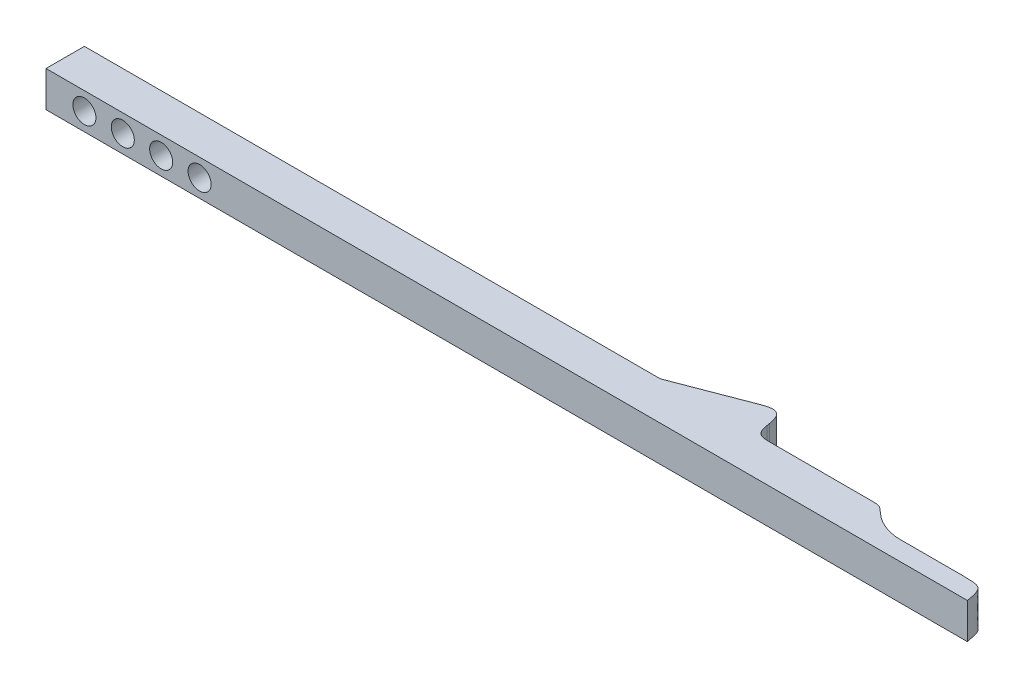
from build123d import *

# Parameters (mm, degrees)
ESBO_O1_W                = 5
ESBO_O1_H                = 4.65
RESSALTO_EXTRUS_O1_DEPTH = 120
RESSALTO_EXTRUS_O2_DEPTH = 4.75
F_3_0MM_DOWEL_HOLE3_D    = 3
CUT_EXTRUDE2_DEPTH       = 10
FILLET4_START            = -3
FILLET4_DEPTH            = 6
FILLET1_SIZE             = 0.5
FILLET6_START            = -2.325
FILLET6_DEPTH            = 4.65
FILLET7_START            = -2.325
FILLET7_DEPTH            = 4.65


with BuildPart() as part:
    # Esboço1 → Ressalto-extrusão1 (new body)
    with BuildSketch(Plane(origin=(0, 0, 0), x_dir=(0, 0, -1), z_dir=(1, 0, 0))):
        with Locations((-2.5, 0)):
            Rectangle(ESBO_O1_W, ESBO_O1_H)
    extrude(amount=RESSALTO_EXTRUS_O1_DEPTH)

    # Esboço2 → Ressalto-extrusão2 (add)
    with BuildSketch(Plane(origin=(0, 2.325, 0), x_dir=(1, 0, 0), z_dir=(0, 1, 0))):
        Polygon((75, 0), (87.5, 0), (86.75, 4.5), align=None)
    extrude(amount=-RESSALTO_EXTRUS_O2_DEPTH)

    # Ø3.0mm Dowel Hole3 (through all)
    with Locations(Plane(origin=(0, 0, 0), x_dir=(-1, 0, 0), z_dir=(0, 0, -1))):
        with Locations((-5, 0), (-10, 0), (-15, 0), (-20, 0)):
            Hole(F_3_0MM_DOWEL_HOLE3_D / 2)

    # Sketch12 → Cut-Extrude2 (cut)
    with BuildSketch(Plane(origin=(0, 2.325, 0), x_dir=(1, 0, 0), z_dir=(0, 1, 0))):
        with BuildLine():
            Line((120, -2.5), (108.780523662, -2.5))
            ThreePointArc((108.780523662, -2.5), (105.971779801, -1.840547319), (103.75, 0))
            Line((103.75, 0), (120, 0))
            Line((120, 0), (120, -2.5))
        make_face()
    extrude(amount=-CUT_EXTRUDE2_DEPTH, mode=Mode.SUBTRACT)

    # Fillet4: read off the stored shape, not the designer's step
    # Fillet4 outline → Fillet4 (cut)
    with BuildSketch(Plane(origin=(0, 0, 0), x_dir=(1, 0, 0), z_dir=(0, 1, 0)).offset(FILLET4_START)):
        with BuildLine():
            add(Edge.make_bspline(
                [(104.477311177, -0.805478659), (103.613151376, 0), (102.431809752, 0)],
                knots=[0, 0, 0, 1, 1, 1], degree=2, weights=[1, 2.791376365, 1]))
            ThreePointArc((104.477311177, -0.805478659), (104.096310112, -0.418401518), (103.75, 0))
            Line((103.75, 0), (102.431809752, 0))
        make_face()
        with BuildLine():
            Line((120, -2.5), (117.041960108, -2.5))
            add(Edge.make_bspline(
                [(120, -5), (119.577422873, -2.5), (117.041960108, -2.5)],
                knots=[0, 0, 0, 1, 1, 1], degree=2, weights=[1, 2.291287847, 1]))
            Line((120, -5), (120, -2.5))
        make_face()
    extrude(amount=FILLET4_DEPTH, mode=Mode.SUBTRACT)

    # Fillet1
    # a fillet whose section is not a circle: 0.5 mm, written as the material it takes off along each edge
    with BuildSketch(Plane(origin=(20, 0, 0), x_dir=(1, 0, 0), z_dir=(0, -1, 0))) as fillet1_piece_1:
        with BuildLine():
            Bezier((1.5 + FILLET1_SIZE, 0), (1.5, 0), (1.5, FILLET1_SIZE), weights=[1, 0.353553391, 1])
            Line((1.5, FILLET1_SIZE), (1.5 - FILLET1_SIZE * 0.02, FILLET1_SIZE))
            Line((1.5 - FILLET1_SIZE * 0.02, FILLET1_SIZE), (1.5 - FILLET1_SIZE * 0.02, -FILLET1_SIZE * 0.02))
            Line((1.5 - FILLET1_SIZE * 0.02, -FILLET1_SIZE * 0.02), (1.5 + FILLET1_SIZE, -FILLET1_SIZE * 0.02))
            Line((1.5 + FILLET1_SIZE, -FILLET1_SIZE * 0.02), (1.5 + FILLET1_SIZE, 0))
        make_face()
    revolve(axis=Axis((20, 0, 0), (0, 0, 1)), mode=Mode.SUBTRACT)
    with BuildSketch(Plane(origin=(15, 0, 0), x_dir=(1, 0, 0), z_dir=(0, -1, 0))) as fillet1_piece_2:
        with BuildLine():
            Bezier((1.5 + FILLET1_SIZE, 0), (1.5, 0), (1.5, FILLET1_SIZE), weights=[1, 0.353553391, 1])
            Line((1.5, FILLET1_SIZE), (1.5 - FILLET1_SIZE * 0.02, FILLET1_SIZE))
            Line((1.5 - FILLET1_SIZE * 0.02, FILLET1_SIZE), (1.5 - FILLET1_SIZE * 0.02, -FILLET1_SIZE * 0.02))
            Line((1.5 - FILLET1_SIZE * 0.02, -FILLET1_SIZE * 0.02), (1.5 + FILLET1_SIZE, -FILLET1_SIZE * 0.02))
            Line((1.5 + FILLET1_SIZE, -FILLET1_SIZE * 0.02), (1.5 + FILLET1_SIZE, 0))
        make_face()
    revolve(axis=Axis((15, 0, 0), (0, 0, 1)), mode=Mode.SUBTRACT)
    with BuildSketch(Plane(origin=(10, 0, 0), x_dir=(1, 0, 0), z_dir=(0, -1, 0))) as fillet1_piece_3:
        with BuildLine():
            Bezier((1.5 + FILLET1_SIZE, 0), (1.5, 0), (1.5, FILLET1_SIZE), weights=[1, 0.353553391, 1])
            Line((1.5, FILLET1_SIZE), (1.5 - FILLET1_SIZE * 0.02, FILLET1_SIZE))
            Line((1.5 - FILLET1_SIZE * 0.02, FILLET1_SIZE), (1.5 - FILLET1_SIZE * 0.02, -FILLET1_SIZE * 0.02))
            Line((1.5 - FILLET1_SIZE * 0.02, -FILLET1_SIZE * 0.02), (1.5 + FILLET1_SIZE, -FILLET1_SIZE * 0.02))
            Line((1.5 + FILLET1_SIZE, -FILLET1_SIZE * 0.02), (1.5 + FILLET1_SIZE, 0))
        make_face()
    revolve(axis=Axis((10, 0, 0), (0, 0, 1)), mode=Mode.SUBTRACT)
    with BuildSketch(Plane(origin=(5, 0, 0), x_dir=(1, 0, 0), z_dir=(0, -1, 0))) as fillet1_piece_4:
        with BuildLine():
            Bezier((1.5 + FILLET1_SIZE, 0), (1.5, 0), (1.5, FILLET1_SIZE), weights=[1, 0.353553391, 1])
            Line((1.5, FILLET1_SIZE), (1.5 - FILLET1_SIZE * 0.02, FILLET1_SIZE))
            Line((1.5 - FILLET1_SIZE * 0.02, FILLET1_SIZE), (1.5 - FILLET1_SIZE * 0.02, -FILLET1_SIZE * 0.02))
            Line((1.5 - FILLET1_SIZE * 0.02, -FILLET1_SIZE * 0.02), (1.5 + FILLET1_SIZE, -FILLET1_SIZE * 0.02))
            Line((1.5 + FILLET1_SIZE, -FILLET1_SIZE * 0.02), (1.5 + FILLET1_SIZE, 0))
        make_face()
    revolve(axis=Axis((5, 0, 0), (0, 0, 1)), mode=Mode.SUBTRACT)

    # Fillet5
    # a fillet whose section is not a circle: 2 mm, written as the material it takes off along each edge
    with BuildSketch(Plane(origin=(86.75, 8.443980956, -4.5), x_dir=(-0.9338567516961642, 0, 0.35764726660704255), z_dir=(0, -1, 0))) as fillet5_piece_1:
        with BuildLine():
            Bezier((2.447592383, 0), (0, 0), (0.487697434, -2.398511973), weights=[1, 1.265499122, 1])
            Line((0.487697434, -2.398511973), (0, 0))
            Line((0, 0), (2.447592383, 0))
        make_face()
    extrude(amount=16.987961913, mode=Mode.SUBTRACT)

    # Fillet6: read off the stored shape, not the designer's step
    # Fillet6 outline → Fillet6 (add)
    with BuildSketch(Plane(origin=(0, 0, 0), x_dir=(1, 0, 0), z_dir=(0, 1, 0)).offset(FILLET6_START)):
        with BuildLine():
            Line((75, 0), (75.345414741, 0.132286497))
            add(Edge.make_bspline(
                [(75.345414741, 0.132286497), (75, 0), (74.630120208, 0)],
                knots=[0, 0, 0, 1, 1, 1], degree=2, weights=[1, 1.966650326, 1]))
            Line((74.630120208, 0), (75, 0))
        make_face()
    extrude(amount=FILLET6_DEPTH)

    # Fillet7: read off the stored shape, not the designer's step
    # Fillet7 outline → Fillet7 (add)
    with BuildSketch(Plane(origin=(0, 0, 0), x_dir=(1, 0, 0), z_dir=(0, 1, 0)).offset(FILLET7_START)):
        with BuildLine():
            Line((87.5, 0), (89.194254177, 0))
            add(Edge.make_bspline(
                [(89.194254177, 0), (87.5, 0), (87.221466329, 1.671202025)],
                knots=[0, 0, 0, 1, 1, 1], degree=2, weights=[1, 1.526039965, 1]))
            Line((87.221466329, 1.671202025), (87.5, 0))
        make_face()
    extrude(amount=FILLET7_DEPTH)


solid = part.part
